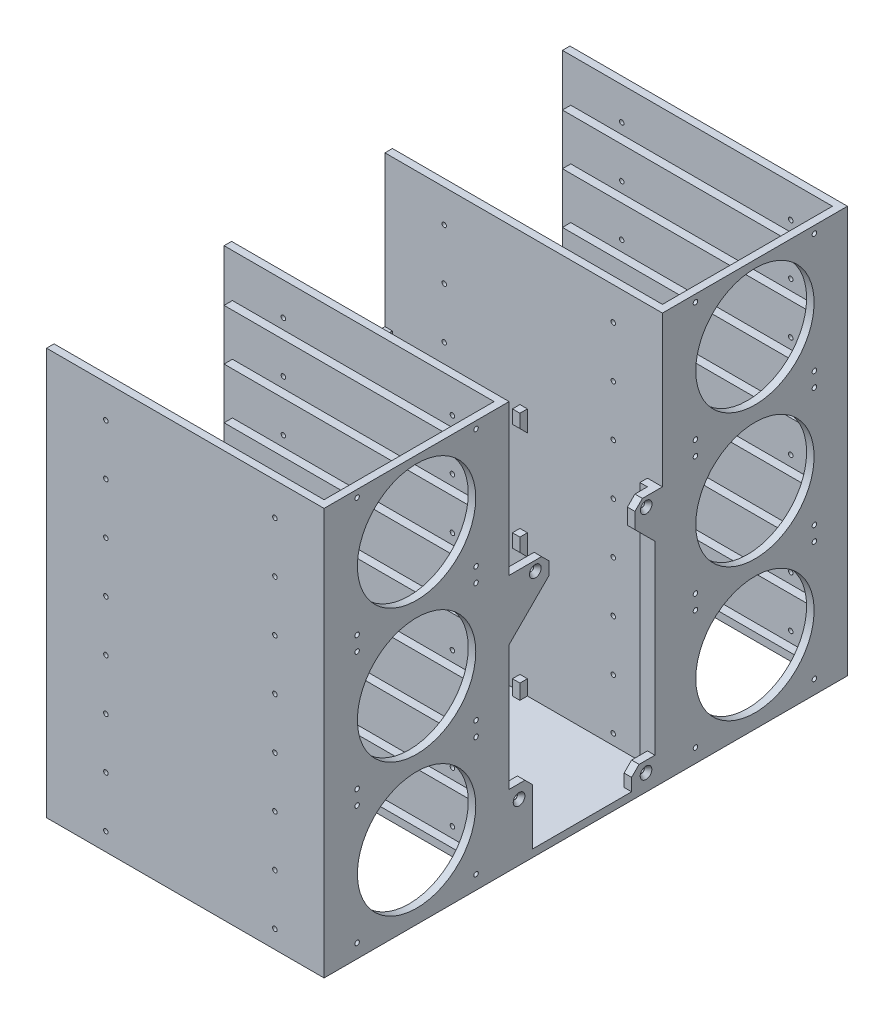
from build123d import *

# Parameters (mm, degrees)
SKETCH1_W                     = 166.5
SKETCH1_H                     = 111
BOSS_EXTRUDE1_DEPTH           = 30.5
SHELL1_T                      = -4.5
CUT_EXTRUDE1_REACH            = 105.377
SKETCH2_W                     = 157
SKETCH2_H                     = 92
TAP_DRILL_FOR_6_32_TAP1_D     = 2.7051
TAP_DRILL_FOR_6_32_TAP1_DEPTH = 4.5
LPATTERN1_COUNT               = 8
LPATTERN1_PITCH               = 30.5
SKETCH7_W                     = 102
SKETCH7_H                     = 4.5
CUT_EXTRUDE2_DEPTH            = 5
SKETCH8_W                     = 102
SKETCH8_H                     = 157
CUT_EXTRUDE3_DEPTH            = 5
CUT_EXTRUDE4_REACH            = 302.564
SKETCH9_R                     = 35.5
TAP_DRILL_FOR_6_32_TAP2_D     = 2.7051
SKETCH13_W                    = 166.5
SKETCH13_H                    = 92
BOSS_EXTRUDE2_DEPTH           = 4.5
CUT_EXTRUDE7_START            = -157
CUT_EXTRUDE7_DEPTH            = 157
MIRROR6_START                 = -157
MIRROR6_COPY_1_DEPTH          = 157
CUT_EXTRUDE11_REACH           = 364.095
SKETCH31_W                    = 5
SKETCH31_H                    = 102
SKETCH33_W                    = 4.5
SKETCH33_H                    = 149.2
BOSS_EXTRUDE3_DEPTH           = 4.5
LPATTERN2_COUNT               = 3
LPATTERN2_PITCH               = 81
CUT_EXTRUDE12_REACH           = 394.531
SKETCH34_W                    = 4.5
SKETCH34_H                    = 11.5
SKETCH35_W                    = 4.5
SKETCH35_H                    = 149.2
BOSS_EXTRUDE4_DEPTH           = 4.5
SKETCH36_W                    = 14
SKETCH36_H                    = 38
SKETCH36_W_2                  = 24
SKETCH36_H_2                  = 12
SKETCH36_W_3                  = 12
SKETCH36_H_3                  = 14
BOSS_EXTRUDE5_DEPTH           = 4.5
CUT_EXTRUDE13_REACH           = 394.531
SKETCH37_R                    = 1.355
BOSS_EXTRUDE6_START           = -4.5
BOSS_EXTRUDE6_DEPTH           = 4.5
SKETCH39_R                    = 3.5
CUT_EXTRUDE14_DEPTH           = 2.5
CUT_EXTRUDE14_DRAFT           = -39
CUT_EXTRUDE14_PROFILE_2_DEPTH = 2.5
CUT_EXTRUDE14_PROFILE_2_DRAFT = -39
CUT_EXTRUDE14_PROFILE_3_DEPTH = 2.5
CUT_EXTRUDE14_PROFILE_3_DRAFT = -39
CUT_EXTRUDE14_PROFILE_4_DEPTH = 2.5
CUT_EXTRUDE14_PROFILE_4_DRAFT = -39
CHAMFER1_SIZE                 = 4.5


with BuildPart() as part:
    # Sketch1 → Boss-Extrude1 (new body)
    with BuildSketch(Plane(origin=(0, 0, 0), x_dir=(1, 0, 0), z_dir=(0, 1, 0))):
        Rectangle(SKETCH1_W, SKETCH1_H)
    extrude(amount=BOSS_EXTRUDE1_DEPTH)

    # Shell1
    shell1_openings = [part.faces().sort_by_distance(p)[0] for p in [
        (0, 30.5, 0),
        (-83.25, 15.25, 0),
    ]]
    offset(amount=SHELL1_T, openings=shell1_openings, kind=Kind.INTERSECTION)

    # Sketch2 → Cut-Extrude1 (cut, up to next)
    with BuildSketch(Plane(origin=(0, 4.5, 0), x_dir=(1, 0, 0), z_dir=(0, 1, 0)), mode=Mode.PRIVATE) as cut_extrude1_sk1:
        with Locations((0.25, 0)):
            Rectangle(SKETCH2_W, SKETCH2_H)
    cut_extrude1_tool1 = extrude(cut_extrude1_sk1.sketch, amount=-CUT_EXTRUDE1_REACH, mode=Mode.PRIVATE) & part.part
    add(cut_extrude1_tool1.solids().sort_by_distance((0.25, 4.5, 0))[0], mode=Mode.SUBTRACT)

    # Tap Drill for #6-32 Tap1
    with Locations(Plane(origin=(0, 0, -55.5), x_dir=(-1, 0, 0), z_dir=(0, 0, -1))):
        with Locations((47.66, 10.84), (-53.75, 10.84)):
            tap_drill_for_6_32_tap1 = Hole(TAP_DRILL_FOR_6_32_TAP1_D / 2, depth=TAP_DRILL_FOR_6_32_TAP1_DEPTH)

    # Mirror1: Tap Drill for #6-32 Tap1 across plane
    add(tap_drill_for_6_32_tap1.mirror(Plane.XY), mode=Mode.SUBTRACT)


with BuildPart() as lpattern1_1:
    # LPattern1: pattern copy
    add(part.part.moved(Location(Vector(0, 1, 0) * (1 * LPATTERN1_PITCH))))


with BuildPart() as lpattern1_2:
    # LPattern1: pattern copy
    add(part.part.moved(Location(Vector(0, 1, 0) * (2 * LPATTERN1_PITCH))))


with BuildPart() as lpattern1_3:
    # LPattern1: pattern copy
    add(part.part.moved(Location(Vector(0, 1, 0) * (3 * LPATTERN1_PITCH))))


with BuildPart() as lpattern1_4:
    # LPattern1: pattern copy
    add(part.part.moved(Location(Vector(0, 1, 0) * (4 * LPATTERN1_PITCH))))


with BuildPart() as lpattern1_5:
    # LPattern1: pattern copy
    add(part.part.moved(Location(Vector(0, 1, 0) * (5 * LPATTERN1_PITCH))))


with BuildPart() as lpattern1_6:
    # LPattern1: pattern copy
    add(part.part.moved(Location(Vector(0, 1, 0) * (6 * LPATTERN1_PITCH))))


with BuildPart() as lpattern1_7:
    # LPattern1: pattern copy
    add(part.part.moved(Location(Vector(0, 1, 0) * (7 * LPATTERN1_PITCH))))


with BuildPart() as part_1:
    add(part.part)

    # Combine1: union LPattern1_1
    add(lpattern1_1.part)

    # Sketch7 → Cut-Extrude2 (cut)
    with BuildSketch(Plane.ZY.offset(83.25)):
        with Locations((0, 32.75)):
            Rectangle(SKETCH7_W, SKETCH7_H)
    extrude(amount=-CUT_EXTRUDE2_DEPTH, mode=Mode.SUBTRACT)


with BuildPart() as lpattern1_2_1:
    add(lpattern1_2.part)

    # Combine2: union LPattern1_3, LPattern1_5, LPattern1_4, LPattern1_7, part, LPattern1_6
    add(lpattern1_3.part)
    add(lpattern1_5.part)
    add(lpattern1_4.part)
    add(lpattern1_7.part)
    add(part_1.part)
    add(lpattern1_6.part)

    # Sketch8 → Cut-Extrude3 (cut)
    with BuildSketch(Plane.ZY.offset(83.25)):
        with Locations((0, 139.5)):
            Rectangle(SKETCH8_W, SKETCH8_H)
    extrude(amount=-CUT_EXTRUDE3_DEPTH, mode=Mode.SUBTRACT)

    # Sketch9 → Cut-Extrude4 (cut, up to next)
    with BuildSketch(Plane(origin=(83.25, 0, 0), x_dir=(0, 0, -1), z_dir=(1, 0, 0)), mode=Mode.PRIVATE) as cut_extrude4_sk1:
        with Locations((0, 204)):
            Circle(SKETCH9_R)
    cut_extrude4_tool1 = extrude(cut_extrude4_sk1.sketch, amount=-CUT_EXTRUDE4_REACH, mode=Mode.PRIVATE) & lpattern1_2_1.part
    # Sketch9 → Cut-Extrude4 (cut, up to next)
    with BuildSketch(Plane(origin=(83.25, 0, 0), x_dir=(0, 0, -1), z_dir=(1, 0, 0)), mode=Mode.PRIVATE) as cut_extrude4_sk2:
        with Locations((0, 124)):
            Circle(SKETCH9_R)
    cut_extrude4_tool2 = extrude(cut_extrude4_sk2.sketch, amount=-CUT_EXTRUDE4_REACH, mode=Mode.PRIVATE) & lpattern1_2_1.part
    # Sketch9 → Cut-Extrude4 (cut, up to next)
    with BuildSketch(Plane(origin=(83.25, 0, 0), x_dir=(0, 0, -1), z_dir=(1, 0, 0)), mode=Mode.PRIVATE) as cut_extrude4_sk3:
        with Locations((0, 44)):
            Circle(SKETCH9_R)
    cut_extrude4_tool3 = extrude(cut_extrude4_sk3.sketch, amount=-CUT_EXTRUDE4_REACH, mode=Mode.PRIVATE) & lpattern1_2_1.part
    add(cut_extrude4_tool1.solids().sort_by_distance((83.25, 204, 0))[0], mode=Mode.SUBTRACT)
    add(cut_extrude4_tool2.solids().sort_by_distance((83.25, 124, 0))[0], mode=Mode.SUBTRACT)
    add(cut_extrude4_tool3.solids().sort_by_distance((83.25, 44, 0))[0], mode=Mode.SUBTRACT)

    # Tap Drill for #6-32 Tap2 (through all)
    with Locations(Plane(origin=(83.25, 0, 0), x_dir=(0, 0, -1), z_dir=(1, 0, 0))):
        with Locations((-35.675, 239.675), (35.675, 239.675), (35.675, 168.325), (-35.675, 168.325)):
            tap_drill_for_6_32_tap2 = Hole(TAP_DRILL_FOR_6_32_TAP2_D / 2)

    # Mirror2: Tap Drill for #6-32 Tap2 across plane
    add(tap_drill_for_6_32_tap2.mirror(Plane.ZX.offset(164)), mode=Mode.SUBTRACT)

    # Mirror3: Tap Drill for #6-32 Tap2 across plane
    add(tap_drill_for_6_32_tap2.mirror(Plane.ZX.offset(124)), mode=Mode.SUBTRACT)

    # Sketch13 → Boss-Extrude2 (add)
    with BuildSketch(Plane.XZ):
        with Locations((0, -101.5)):
            Rectangle(SKETCH13_W, SKETCH13_H)
    extrude(amount=-BOSS_EXTRUDE2_DEPTH)

    # Mirror4: LPattern1_2 across plane


with BuildPart() as lpattern1_2_2:
    add(lpattern1_2_1.part)
    add(lpattern1_2_1.part.mirror(Plane(origin=(0, 0, -101.5), x_dir=(1, 0, 0), z_dir=(0, 0, -1))))

    # Sketch17 → Cut-Extrude7 (cut)
    with BuildSketch(Plane.ZY.offset(78.25).offset(CUT_EXTRUDE7_START)):
        Polygon((-46, 35), (-51, 30.5), (-46, 30.5), align=None)
        Polygon((-51, 61), (-46, 65.5), (-46, 61), align=None)
        Polygon((-51, 91.5), (-46, 96), (-46, 91.5), align=None)
        Polygon((-51, 122), (-46, 126.5), (-46, 122), align=None)
        Polygon((-51, 152.5), (-46, 157), (-46, 152.5), align=None)
        Polygon((-51, 183), (-46, 187.5), (-46, 183), align=None)
        Polygon((-51, 213.5), (-46, 218), (-46, 213.5), align=None)
    cut_extrude7 = extrude(amount=CUT_EXTRUDE7_DEPTH, mode=Mode.SUBTRACT)

    # Mirror5: Cut-Extrude7 across plane
    add(cut_extrude7.mirror(Plane.XY), mode=Mode.SUBTRACT)

    # Mirror6: Cut-Extrude7 across plane
    add(cut_extrude7.mirror(Plane(origin=(0, 0, -101.5), x_dir=(1, 0, 0), z_dir=(0, 0, -1))), mode=Mode.SUBTRACT)

    # Mirror6 copy 1 sketch → Mirror6 copy 1 (cut)
    with BuildSketch(Plane(origin=(-78.25, 0, -203), x_dir=(0, 0, 1), z_dir=(-1, 0, 0)).offset(MIRROR6_START)):
        Polygon((-46, 35), (-51, 30.5), (-46, 30.5), align=None)
        Polygon((-51, 61), (-46, 65.5), (-46, 61), align=None)
        Polygon((-51, 91.5), (-46, 96), (-46, 91.5), align=None)
        Polygon((-51, 122), (-46, 126.5), (-46, 122), align=None)
        Polygon((-51, 152.5), (-46, 157), (-46, 152.5), align=None)
        Polygon((-51, 183), (-46, 187.5), (-46, 183), align=None)
        Polygon((-51, 213.5), (-46, 218), (-46, 213.5), align=None)
    extrude(amount=MIRROR6_COPY_1_DEPTH, mode=Mode.SUBTRACT)

    # Sketch31 → Cut-Extrude11 (cut, up to next)
    with BuildSketch(Plane(origin=(0, 4.5, 0), x_dir=(1, 0, 0), z_dir=(0, 1, 0)), mode=Mode.PRIVATE) as cut_extrude11_sk1:
        with Locations((-80.75, 203)):
            Rectangle(SKETCH31_W, SKETCH31_H)
    cut_extrude11_tool1 = extrude(cut_extrude11_sk1.sketch, amount=-CUT_EXTRUDE11_REACH, mode=Mode.PRIVATE) & lpattern1_2_2.part
    # Sketch31 → Cut-Extrude11 (cut, up to next)
    with BuildSketch(Plane(origin=(0, 4.5, 0), x_dir=(1, 0, 0), z_dir=(0, 1, 0)), mode=Mode.PRIVATE) as cut_extrude11_sk2:
        with Locations((-80.75, 0)):
            Rectangle(SKETCH31_W, SKETCH31_H)
    cut_extrude11_tool2 = extrude(cut_extrude11_sk2.sketch, amount=-CUT_EXTRUDE11_REACH, mode=Mode.PRIVATE) & lpattern1_2_2.part
    add(cut_extrude11_tool1.solids().sort_by_distance((-80.75, 4.5, -203))[0], mode=Mode.SUBTRACT)
    add(cut_extrude11_tool2.solids().sort_by_distance((-80.75, 4.5, 0))[0], mode=Mode.SUBTRACT)

    # Sketch33 → Boss-Extrude3 (add)
    with BuildSketch(Plane(origin=(83.25, 0, 0), x_dir=(0, 0, -1), z_dir=(1, 0, 0))):
        with Locations((145.25, 79.1)):
            Rectangle(SKETCH33_W, SKETCH33_H)
    boss_extrude3 = extrude(amount=-BOSS_EXTRUDE3_DEPTH)

    # LPattern2: Boss-Extrude3 ×3
    with Locations(*[(-i * LPATTERN2_PITCH, 0, 0) for i in range(1, LPATTERN2_COUNT)]):
        add(boss_extrude3)

    # Cut-Extrude12: up to this face of the body (flat: up to its plane)
    cut_extrude12_end = Plane(lpattern1_2_2.part.faces().sort_by_distance((2.25, 79.1, -145.25))[0])
    # Sketch34 → Cut-Extrude12 (cut, up to the picked face)
    with BuildSketch(Plane.ZY.offset(83.25), mode=Mode.PRIVATE) as cut_extrude12_sk1:
        Polygon((-147.5, 25), (-143, 25), (-143, 81.35), (-147.5, 76.85), align=None)
    cut_extrude12_tool1 = split(extrude(cut_extrude12_sk1.sketch, amount=-CUT_EXTRUDE12_REACH, mode=Mode.PRIVATE), bisect_by=cut_extrude12_end, keep=Keep.BOTH, mode=Mode.PRIVATE)
    # Sketch34 → Cut-Extrude12 (cut, up to the picked face)
    with BuildSketch(Plane.ZY.offset(83.25), mode=Mode.PRIVATE) as cut_extrude12_sk2:
        with Locations((-145.25, 19.25)):
            Rectangle(SKETCH34_W, SKETCH34_H)
    cut_extrude12_tool2 = split(extrude(cut_extrude12_sk2.sketch, amount=-CUT_EXTRUDE12_REACH, mode=Mode.PRIVATE), bisect_by=cut_extrude12_end, keep=Keep.BOTH, mode=Mode.PRIVATE)
    # Sketch34 → Cut-Extrude12 (cut, up to the picked face)
    with BuildSketch(Plane.ZY.offset(83.25), mode=Mode.PRIVATE) as cut_extrude12_sk3:
        Polygon((-143, 145.7), (-143, 89.35), (-147.5, 89.35), (-147.5, 141.2), align=None)
    cut_extrude12_tool3 = split(extrude(cut_extrude12_sk3.sketch, amount=-CUT_EXTRUDE12_REACH, mode=Mode.PRIVATE), bisect_by=cut_extrude12_end, keep=Keep.BOTH, mode=Mode.PRIVATE)
    add(cut_extrude12_tool1.solids().sort_by(Axis((-83.25, 52.065596, -145.218808), (1, 0, 0)))[0], mode=Mode.SUBTRACT)
    add(cut_extrude12_tool2.solids().sort_by(Axis((-83.25, 19.25, -145.25), (1, 0, 0)))[0], mode=Mode.SUBTRACT)
    add(cut_extrude12_tool3.solids().sort_by(Axis((-83.25, 116.415596, -145.218808), (1, 0, 0)))[0], mode=Mode.SUBTRACT)

    # Sketch35 → Boss-Extrude4 (add)
    with BuildSketch(Plane.ZY.offset(-78.75)):
        with Locations((-145.25, 79.1)):
            Rectangle(SKETCH35_W, SKETCH35_H)
    extrude(amount=BOSS_EXTRUDE4_DEPTH)

    # Sketch36 → Boss-Extrude5 (add)
    with BuildSketch(Plane(origin=(83.25, 0, 0), x_dir=(0, 0, -1), z_dir=(1, 0, 0))):
        with Locations((62.5, 23.5)):
            Rectangle(SKETCH36_W, SKETCH36_H)
        with Locations((67.5, 147.7)):
            Rectangle(SKETCH36_W_2, SKETCH36_H_2)
        with Locations((137, 146.7)):
            Rectangle(SKETCH36_W_3, SKETCH36_H_3)
        with Locations((136, 10.5)):
            Rectangle(SKETCH36_W, SKETCH36_H_2)
    extrude(amount=-BOSS_EXTRUDE5_DEPTH)

    # Sketch37 → Cut-Extrude13 (cut, up to next)
    with BuildSketch(Plane(origin=(83.25, 0, 0), x_dir=(0, 0, -1), z_dir=(1, 0, 0)), mode=Mode.PRIVATE) as cut_extrude13_sk1:
        with Locations((71.225, 148.015)):
            Circle(SKETCH37_R)
    cut_extrude13_tool1 = extrude(cut_extrude13_sk1.sketch, amount=-CUT_EXTRUDE13_REACH, mode=Mode.PRIVATE) & lpattern1_2_2.part
    # Sketch37 → Cut-Extrude13 (cut, up to next)
    with BuildSketch(Plane(origin=(83.25, 0, 0), x_dir=(0, 0, -1), z_dir=(1, 0, 0)), mode=Mode.PRIVATE) as cut_extrude13_sk2:
        with Locations((137.775, 148.015)):
            Circle(SKETCH37_R)
    cut_extrude13_tool2 = extrude(cut_extrude13_sk2.sketch, amount=-CUT_EXTRUDE13_REACH, mode=Mode.PRIVATE) & lpattern1_2_2.part
    # Sketch37 → Cut-Extrude13 (cut, up to next)
    with BuildSketch(Plane(origin=(83.25, 0, 0), x_dir=(0, 0, -1), z_dir=(1, 0, 0)), mode=Mode.PRIVATE) as cut_extrude13_sk3:
        with Locations((61.475, 34.415)):
            Circle(SKETCH37_R)
    cut_extrude13_tool3 = extrude(cut_extrude13_sk3.sketch, amount=-CUT_EXTRUDE13_REACH, mode=Mode.PRIVATE) & lpattern1_2_2.part
    # Sketch37 → Cut-Extrude13 (cut, up to next)
    with BuildSketch(Plane(origin=(83.25, 0, 0), x_dir=(0, 0, -1), z_dir=(1, 0, 0)), mode=Mode.PRIVATE) as cut_extrude13_sk4:
        with Locations((137.645, 10.055)):
            Circle(SKETCH37_R)
    cut_extrude13_tool4 = extrude(cut_extrude13_sk4.sketch, amount=-CUT_EXTRUDE13_REACH, mode=Mode.PRIVATE) & lpattern1_2_2.part
    add(cut_extrude13_tool1.solids().sort_by_distance((83.25, 148.015, -71.225))[0], mode=Mode.SUBTRACT)
    add(cut_extrude13_tool2.solids().sort_by_distance((83.25, 148.015, -137.775))[0], mode=Mode.SUBTRACT)
    add(cut_extrude13_tool3.solids().sort_by_distance((83.25, 34.415, -61.475))[0], mode=Mode.SUBTRACT)
    add(cut_extrude13_tool4.solids().sort_by_distance((83.25, 10.055, -137.645))[0], mode=Mode.SUBTRACT)

    # Sketch38 → Boss-Extrude6 (add)
    with BuildSketch(Plane(origin=(83.25, 0, 0), x_dir=(0, 0, -1), z_dir=(1, 0, 0)).offset(BOSS_EXTRUDE6_START)):
        Polygon((79.5, 141.7), (55.5, 117.7), (55.5, 141.7), align=None)
        Polygon((131, 139.7), (143, 127.7), (143, 139.7), align=None)
    extrude(amount=BOSS_EXTRUDE6_DEPTH)


with BuildPart() as cut_extrude14_tool:
    # Sketch39 → Cut-Extrude14 (with draft: the straight prism first)
    with BuildSketch(Plane(origin=(83.25, 0, 0), x_dir=(0, 0, -1), z_dir=(1, 0, 0))):
        with Locations((71.225, 148.015)):
            Circle(SKETCH39_R)
    extrude(amount=-CUT_EXTRUDE14_DEPTH)
    # Cut-Extrude14: the draft: its side faces are tilted about the plane it starts from
    cut_extrude14_sides = [cut_extrude14_tool.faces().sort_by_distance(p)[0] for p in [
        (82, 148.015, -67.725),
    ]]
    draft(cut_extrude14_sides, Plane(origin=(83.25, 0, 0), x_dir=(0, 0, -1), z_dir=(1, 0, 0)), CUT_EXTRUDE14_DRAFT)


with BuildPart() as lpattern1_2_3:
    add(lpattern1_2_2.part)

    # Cut-Extrude14: cut by cut_extrude14_tool
    add(cut_extrude14_tool.part, mode=Mode.SUBTRACT)


with BuildPart() as cut_extrude14_profile_2_tool:
    # Sketch39 → Cut-Extrude14 profile 2 (with draft: the straight prism first)
    with BuildSketch(Plane(origin=(83.25, 0, 0), x_dir=(0, 0, -1), z_dir=(1, 0, 0))):
        with Locations((137.775, 148.015)):
            Circle(SKETCH39_R)
    extrude(amount=-CUT_EXTRUDE14_PROFILE_2_DEPTH)
    # Cut-Extrude14 profile 2: the draft: its side faces are tilted about the plane it starts from
    cut_extrude14_profile_2_sides = [cut_extrude14_profile_2_tool.faces().sort_by_distance(p)[0] for p in [
        (82, 148.015, -134.275),
    ]]
    draft(cut_extrude14_profile_2_sides, Plane(origin=(83.25, 0, 0), x_dir=(0, 0, -1), z_dir=(1, 0, 0)), CUT_EXTRUDE14_PROFILE_2_DRAFT)


with BuildPart() as lpattern1_2_4:
    add(lpattern1_2_3.part)

    # Cut-Extrude14 profile 2: cut by cut_extrude14_profile_2_tool
    add(cut_extrude14_profile_2_tool.part, mode=Mode.SUBTRACT)


with BuildPart() as cut_extrude14_profile_3_tool:
    # Sketch39 → Cut-Extrude14 profile 3 (with draft: the straight prism first)
    with BuildSketch(Plane(origin=(83.25, 0, 0), x_dir=(0, 0, -1), z_dir=(1, 0, 0))):
        with Locations((137.645, 10.055)):
            Circle(SKETCH39_R)
    extrude(amount=-CUT_EXTRUDE14_PROFILE_3_DEPTH)
    # Cut-Extrude14 profile 3: the draft: its side faces are tilted about the plane it starts from
    cut_extrude14_profile_3_sides = [cut_extrude14_profile_3_tool.faces().sort_by_distance(p)[0] for p in [
        (82, 10.055, -134.145),
    ]]
    draft(cut_extrude14_profile_3_sides, Plane(origin=(83.25, 0, 0), x_dir=(0, 0, -1), z_dir=(1, 0, 0)), CUT_EXTRUDE14_PROFILE_3_DRAFT)


with BuildPart() as lpattern1_2_5:
    add(lpattern1_2_4.part)

    # Cut-Extrude14 profile 3: cut by cut_extrude14_profile_3_tool
    add(cut_extrude14_profile_3_tool.part, mode=Mode.SUBTRACT)


with BuildPart() as cut_extrude14_profile_4_tool:
    # Sketch39 → Cut-Extrude14 profile 4 (with draft: the straight prism first)
    with BuildSketch(Plane(origin=(83.25, 0, 0), x_dir=(0, 0, -1), z_dir=(1, 0, 0))):
        with Locations((61.475, 34.415)):
            Circle(SKETCH39_R)
    extrude(amount=-CUT_EXTRUDE14_PROFILE_4_DEPTH)
    # Cut-Extrude14 profile 4: the draft: its side faces are tilted about the plane it starts from
    cut_extrude14_profile_4_sides = [cut_extrude14_profile_4_tool.faces().sort_by_distance(p)[0] for p in [
        (82, 34.415, -57.975),
    ]]
    draft(cut_extrude14_profile_4_sides, Plane(origin=(83.25, 0, 0), x_dir=(0, 0, -1), z_dir=(1, 0, 0)), CUT_EXTRUDE14_PROFILE_4_DRAFT)


with BuildPart() as lpattern1_2_6:
    add(lpattern1_2_5.part)

    # Cut-Extrude14 profile 4: cut by cut_extrude14_profile_4_tool
    add(cut_extrude14_profile_4_tool.part, mode=Mode.SUBTRACT)

    # Chamfer1
    chamfer1_edges = [lpattern1_2_6.edges().sort_by_distance(p)[0] for p in [
        (81, 42.5, -69.5),
        (81, 153.7, -79.5),
        (81, 153.7, -131),
        (81, 16.5, -129),
    ]]
    chamfer(chamfer1_edges, length=CHAMFER1_SIZE)


solid = lpattern1_2_6.part
